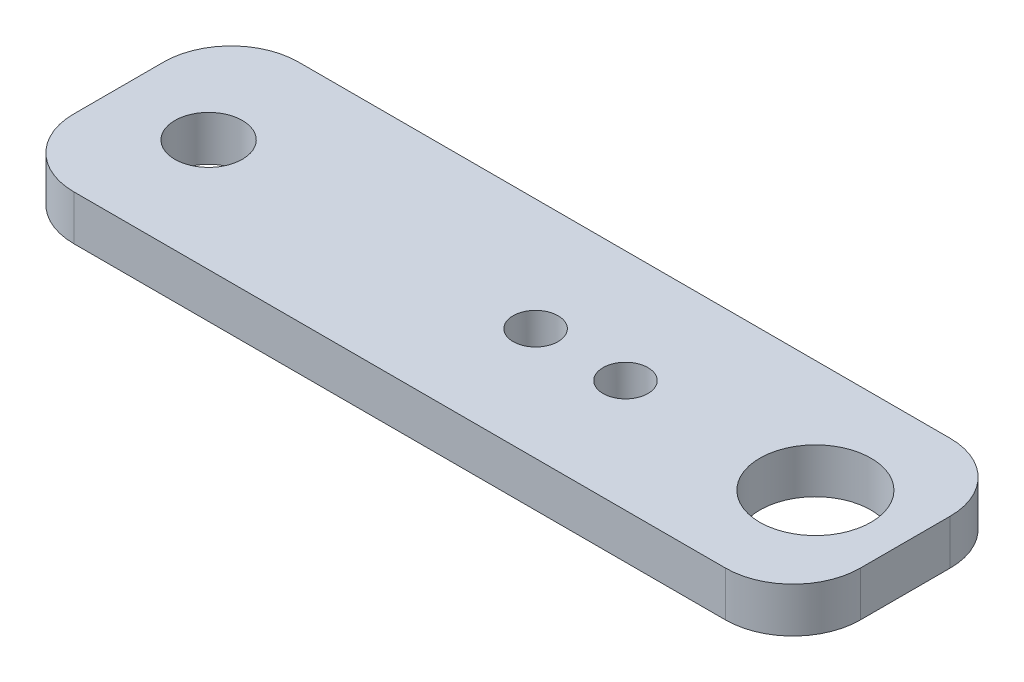
from build123d import *

# Parameters (mm, degrees)
SKETCH1_W                = 35
SKETCH1_H                = 10
BOSS_EXTRUDE1_DEPTH      = 2
SKETCH2_R                = 2.472864358
SKETCH2_R_2              = 1
CUT_EXTRUDE1_DEPTH       = 3
FILLET1_R                = 3
F_3_0_3_DIAMETER_HOLE1_D = 3


with BuildPart() as part:
    # Sketch1 → Boss-Extrude1 (new body)
    with BuildSketch(Plane(origin=(0, 0, 0), x_dir=(1, 0, 0), z_dir=(0, 1, 0))):
        Rectangle(SKETCH1_W, SKETCH1_H)
    extrude(amount=BOSS_EXTRUDE1_DEPTH)

    # Sketch2 → Cut-Extrude1 (cut)
    with BuildSketch(Plane(origin=(0, 2, 0), x_dir=(1, 0, 0), z_dir=(0, 1, 0))):
        with Locations((13.5, 0)):
            Circle(SKETCH2_R)
        with Locations((5.05, 0)):
            Circle(SKETCH2_R_2)
        with Locations((1.05, 0)):
            Circle(SKETCH2_R_2)
    extrude(amount=-CUT_EXTRUDE1_DEPTH, mode=Mode.SUBTRACT)

    # Fillet1
    fillet1_edges = [part.edges().sort_by_distance(p)[0] for p in [
        (17.5, 1, 5),
        (17.5, 1, -5),
        (-17.5, 1, -5),
        (-17.5, 1, 5),
    ]]
    fillet(fillet1_edges, radius=FILLET1_R)

    # Ø3.0 (3) Diameter Hole1 (through all)
    with Locations(Plane(origin=(0, 2, 0), x_dir=(1, 0, 0), z_dir=(0, 1, 0))):
        with Locations((-13.5, 0)):
            Hole(F_3_0_3_DIAMETER_HOLE1_D / 2)


solid = part.part
